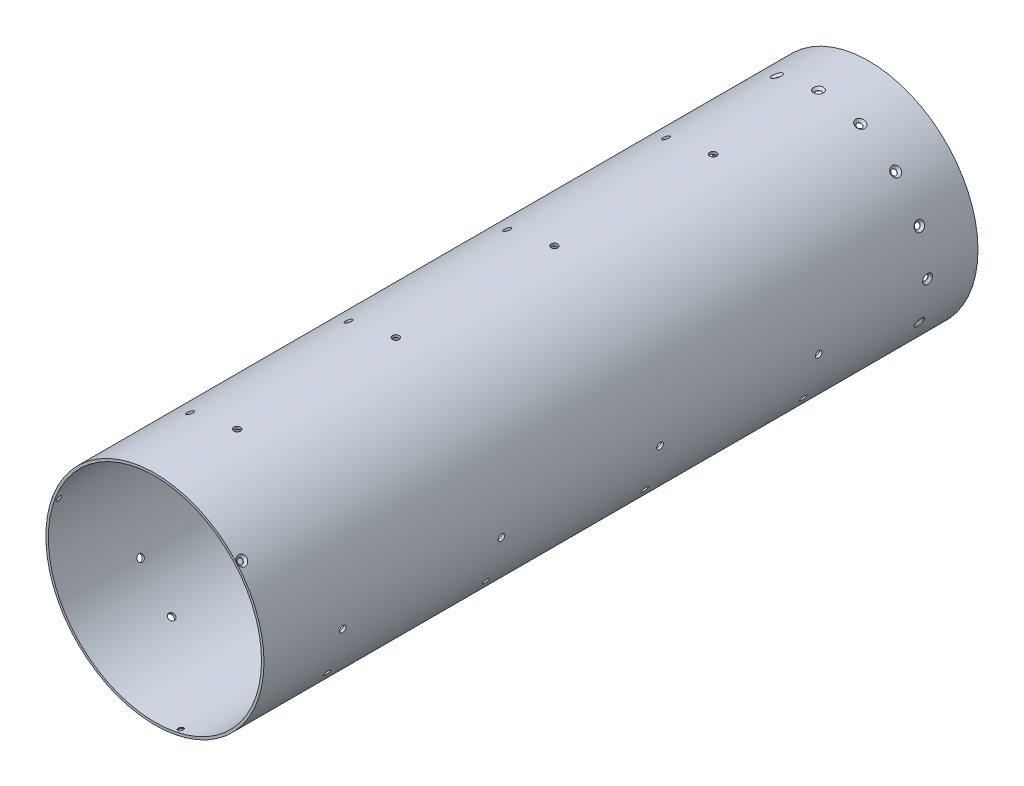
from build123d import *

# Parameters (mm, degrees)
SKETCH1_R                                       = 69.85
SKETCH1_R_2                                     = 68.2625
EXTRUDE1_DEPTH                                  = 457.2
CSK_FOR_M3_FLAT_HEAD_MACHINE_SCREW1_D           = 3.4
CSK_FOR_M3_FLAT_HEAD_MACHINE_SCREW1_CSINK_D     = 6.3
CSK_FOR_M3_FLAT_HEAD_MACHINE_SCREW1_CSINK_ANGLE = 90
CIRPATTERN1_COUNT                               = 16
F_10_CLEARANCE_HOLE1_D                          = 5.1054
F_10_CLEARANCE_HOLE1_DEPTH                      = 12.7
F_10_CLEARANCE_HOLE1_TIP                        = 1.533816902
CIRPATTERN2_COUNT                               = 3
CIRPATTERN3_COUNT                               = 3
LPATTERN1_COUNT                                 = 4
LPATTERN1_PITCH                                 = 101.6


with BuildPart() as part:
    # Sketch1 → Extrude1 (new body)
    with BuildSketch(Plane.XY):
        Circle(SKETCH1_R)
        Circle(SKETCH1_R_2, mode=Mode.SUBTRACT)
    extrude(amount=EXTRUDE1_DEPTH)

    # CSK for M3 Flat Head Machine Screw1 (through all)
    with Locations(Plane(origin=(0, -69.85, 32.258), x_dir=(1, 0, 0), z_dir=(0, -1, 0))):
        with Locations((0, 0)):
            csk_for_m3_flat_head_machine_screw1 = CounterSinkHole(CSK_FOR_M3_FLAT_HEAD_MACHINE_SCREW1_D / 2, CSK_FOR_M3_FLAT_HEAD_MACHINE_SCREW1_CSINK_D / 2, counter_sink_angle=CSK_FOR_M3_FLAT_HEAD_MACHINE_SCREW1_CSINK_ANGLE)

    # CirPattern1: CSK for M3 Flat Head Machine Screw1 ×16 about axis
    cirpattern1_axis = Axis((0, 0, 457.2), (0, 0, -1))
    for i in range(1, CIRPATTERN1_COUNT):
        add(csk_for_m3_flat_head_machine_screw1.rotate(cirpattern1_axis, i * 360 / CIRPATTERN1_COUNT), mode=Mode.SUBTRACT)

    # #10 Clearance Hole1
    with Locations(Plane(origin=(13.627058993, -68.507851836, 32.258), x_dir=(0.9807852804032304, 0.19509032201612855, 0), z_dir=(0.19509032201612853, -0.9807852804032303, 0))):
        with Locations((0, 0)):
            Hole(F_10_CLEARANCE_HOLE1_D / 2, depth=F_10_CLEARANCE_HOLE1_DEPTH)
            with Locations((0, 0, -(F_10_CLEARANCE_HOLE1_DEPTH + F_10_CLEARANCE_HOLE1_TIP / 2))):  # 118° drill point
                Cone(0, F_10_CLEARANCE_HOLE1_D / 2, F_10_CLEARANCE_HOLE1_TIP, mode=Mode.SUBTRACT)

    # Sketch16 → CSK for M3 Flat Head Machine Screw2 (revolve, cut)
    with BuildSketch(Plane(origin=(13.627058993, -68.507851836, 454.025), x_dir=(0.9807852804032305, 0.19509032201612853, 0), z_dir=(0, 0, 1))):
        Polygon((0, 0), (0, 8.641463052), (1.7, 7.62), (1.7, 1.45), (3.15, 0), align=None)
    csk_for_m3_flat_head_machine_screw2 = revolve(axis=Axis((14.865882538, -74.735838367, 454.025), (-0.19509032201612853, 0.9807852804032304, 0)), mode=Mode.SUBTRACT)

    # CirPattern2: CSK for M3 Flat Head Machine Screw2 ×3 about axis
    cirpattern2_axis = Axis((0, 0, 457.2), (0, 0, -1))
    for i in range(1, CIRPATTERN2_COUNT):
        add(csk_for_m3_flat_head_machine_screw2.rotate(cirpattern2_axis, i * 360 / CIRPATTERN2_COUNT), mode=Mode.SUBTRACT)

    # Sketch22 → #6 Clearance Hole1 (revolve, cut)
    with BuildSketch(Plane(origin=(1.843612897, 69.825665707, 406.4), x_dir=(-0.9996516207219984, 0.02639388542602123, 0), z_dir=(0, 0, 1))):
        Polygon((0, 0), (0, 13.993442612), (2.15265, 12.7), (2.15265, 0), align=None)
    f_6_clearance_hole1 = revolve(axis=Axis((2.011214069, 76.173453499, 406.4), (-0.02639388542602123, -0.9996516207219983, 0)), mode=Mode.SUBTRACT)

    # Sketch24 → #6 Clearance Hole2 (revolve, cut)
    with BuildSketch(Plane(origin=(-28.424401642, 63.80498328, 406.4), x_dir=(-0.9134571693585092, -0.40693488391576826, 0), z_dir=(0, 0, 1))):
        Polygon((0, 0), (0, 13.993442612), (2.15265, 12.7), (2.15265, 0), align=None)
    f_6_clearance_hole2 = revolve(axis=Axis((-31.008438154, 69.605436305, 406.4), (0.4069348839157684, -0.9134571693585093, 0)), mode=Mode.SUBTRACT)

    # CirPattern3: #6 Clearance Hole1, #6 Clearance Hole2 ×3 about axis
    cirpattern3_axis = Axis((0, 0, 457.2), (0, 0, -1))
    add([f_6_clearance_hole1.rotate(cirpattern3_axis, i * 360 / CIRPATTERN3_COUNT) for i in range(1, CIRPATTERN3_COUNT)], mode=Mode.SUBTRACT)
    add([f_6_clearance_hole2.rotate(cirpattern3_axis, i * 360 / CIRPATTERN3_COUNT) for i in range(1, CIRPATTERN3_COUNT)], mode=Mode.SUBTRACT)

    # LPattern1: #6 Clearance Hole1, #6 Clearance Hole2 ×4
    with Locations(*[(0, 0, -i * LPATTERN1_PITCH) for i in range(1, LPATTERN1_COUNT)]):
        add(f_6_clearance_hole1, mode=Mode.SUBTRACT)
        add(f_6_clearance_hole2, mode=Mode.SUBTRACT)

    # LPattern1 copy 1 sketch → LPattern1 copy 1 (revolve, cut)
    with BuildSketch(Plane(origin=(59.54899389, -36.509448457, 304.8), x_dir=(0.5226835856445092, 0.8525267557665266, 0), z_dir=(0, 0, 1))):
        Polygon((0, 0), (0, 13.993442612), (2.15265, 12.7), (2.15265, 0), align=None)
    revolve(axis=Axis((64.962538789, -39.828489226, 304.8), (-0.8525267557665265, 0.5226835856445092, 0)), mode=Mode.SUBTRACT)

    # LPattern1 copy 2 sketch → LPattern1 copy 2 (revolve, cut)
    with BuildSketch(Plane(origin=(59.54899389, -36.509448457, 203.2), x_dir=(0.5226835856445092, 0.8525267557665266, 0), z_dir=(0, 0, 1))):
        Polygon((0, 0), (0, 13.993442612), (2.15265, 12.7), (2.15265, 0), align=None)
    revolve(axis=Axis((64.962538789, -39.828489226, 203.2), (-0.8525267557665265, 0.5226835856445092, 0)), mode=Mode.SUBTRACT)

    # LPattern1 copy 3 sketch → LPattern1 copy 3 (revolve, cut)
    with BuildSketch(Plane(origin=(59.54899389, -36.509448457, 101.6), x_dir=(0.5226835856445092, 0.8525267557665266, 0), z_dir=(0, 0, 1))):
        Polygon((0, 0), (0, 13.993442612), (2.15265, 12.7), (2.15265, 0), align=None)
    revolve(axis=Axis((64.962538789, -39.828489226, 101.6), (-0.8525267557665265, 0.5226835856445092, 0)), mode=Mode.SUBTRACT)

    # LPattern1 copy 4 sketch → LPattern1 copy 4 (revolve, cut)
    with BuildSketch(Plane(origin=(-61.392606787, -33.31621725, 304.8), x_dir=(0.4769680350774894, -0.8789206411925475, 0), z_dir=(0, 0, 1))):
        Polygon((0, 0), (0, 13.993442612), (2.15265, 12.7), (2.15265, 0), align=None)
    revolve(axis=Axis((-66.973752859, -36.344964273, 304.8), (0.8789206411925474, 0.47696803507748936, 0)), mode=Mode.SUBTRACT)

    # LPattern1 copy 5 sketch → LPattern1 copy 5 (revolve, cut)
    with BuildSketch(Plane(origin=(-61.392606787, -33.31621725, 203.2), x_dir=(0.4769680350774894, -0.8789206411925475, 0), z_dir=(0, 0, 1))):
        Polygon((0, 0), (0, 13.993442612), (2.15265, 12.7), (2.15265, 0), align=None)
    revolve(axis=Axis((-66.973752859, -36.344964273, 203.2), (0.8789206411925474, 0.47696803507748936, 0)), mode=Mode.SUBTRACT)

    # LPattern1 copy 6 sketch → LPattern1 copy 6 (revolve, cut)
    with BuildSketch(Plane(origin=(-61.392606787, -33.31621725, 101.6), x_dir=(0.4769680350774894, -0.8789206411925475, 0), z_dir=(0, 0, 1))):
        Polygon((0, 0), (0, 13.993442612), (2.15265, 12.7), (2.15265, 0), align=None)
    revolve(axis=Axis((-66.973752859, -36.344964273, 101.6), (0.8789206411925474, 0.47696803507748936, 0)), mode=Mode.SUBTRACT)

    # LPattern1 copy 7 sketch → LPattern1 copy 7 (revolve, cut)
    with BuildSketch(Plane(origin=(69.468937229, -7.286237731, 304.8), x_dir=(0.10431263752212744, 0.9945445558913774, 0), z_dir=(0, 0, 1))):
        Polygon((0, 0), (0, 13.993442612), (2.15265, 12.7), (2.15265, 0), align=None)
    revolve(axis=Axis((75.784295159, -7.948622979, 304.8), (-0.9945445558913776, 0.10431263752212744, 0)), mode=Mode.SUBTRACT)

    # LPattern1 copy 8 sketch → LPattern1 copy 8 (revolve, cut)
    with BuildSketch(Plane(origin=(69.468937229, -7.286237731, 203.2), x_dir=(0.10431263752212744, 0.9945445558913774, 0), z_dir=(0, 0, 1))):
        Polygon((0, 0), (0, 13.993442612), (2.15265, 12.7), (2.15265, 0), align=None)
    revolve(axis=Axis((75.784295159, -7.948622979, 203.2), (-0.9945445558913776, 0.10431263752212744, 0)), mode=Mode.SUBTRACT)

    # LPattern1 copy 9 sketch → LPattern1 copy 9 (revolve, cut)
    with BuildSketch(Plane(origin=(69.468937229, -7.286237731, 101.6), x_dir=(0.10431263752212744, 0.9945445558913774, 0), z_dir=(0, 0, 1))):
        Polygon((0, 0), (0, 13.993442612), (2.15265, 12.7), (2.15265, 0), align=None)
    revolve(axis=Axis((75.784295159, -7.948622979, 101.6), (-0.9945445558913776, 0.10431263752212744, 0)), mode=Mode.SUBTRACT)

    # LPattern1 copy 10 sketch → LPattern1 copy 10 (revolve, cut)
    with BuildSketch(Plane(origin=(-41.044535587, -56.518745549, 304.8), x_dir=(0.8091445318363817, -0.5876096719756086, 0), z_dir=(0, 0, 1))):
        Polygon((0, 0), (0, 13.993442612), (2.15265, 12.7), (2.15265, 0), align=None)
    revolve(axis=Axis((-44.775857005, -61.656813326, 304.8), (0.5876096719756088, 0.8091445318363819, 0)), mode=Mode.SUBTRACT)

    # LPattern1 copy 11 sketch → LPattern1 copy 11 (revolve, cut)
    with BuildSketch(Plane(origin=(-41.044535587, -56.518745549, 203.2), x_dir=(0.8091445318363817, -0.5876096719756086, 0), z_dir=(0, 0, 1))):
        Polygon((0, 0), (0, 13.993442612), (2.15265, 12.7), (2.15265, 0), align=None)
    revolve(axis=Axis((-44.775857005, -61.656813326, 203.2), (0.5876096719756088, 0.8091445318363819, 0)), mode=Mode.SUBTRACT)

    # LPattern1 copy 12 sketch → LPattern1 copy 12 (revolve, cut)
    with BuildSketch(Plane(origin=(-41.044535587, -56.518745549, 101.6), x_dir=(0.8091445318363817, -0.5876096719756086, 0), z_dir=(0, 0, 1))):
        Polygon((0, 0), (0, 13.993442612), (2.15265, 12.7), (2.15265, 0), align=None)
    revolve(axis=Axis((-44.775857005, -61.656813326, 101.6), (0.5876096719756088, 0.8091445318363819, 0)), mode=Mode.SUBTRACT)


solid = part.part
